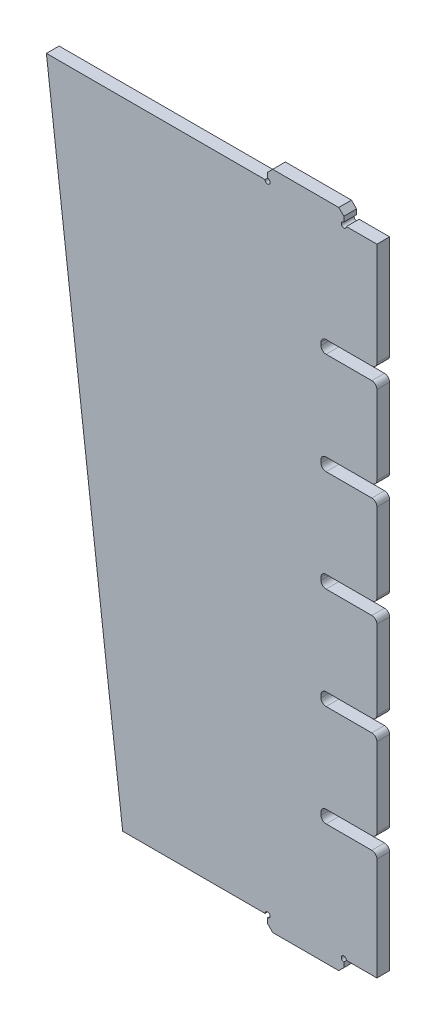
from build123d import *

# Parameters (mm, degrees)
EXTRUDE_1_DEPTH = 2.5
FILLET_1_R      = 2


with BuildPart() as part:
    # 草圖1 → 填料-伸長1 (new, symmetric)
    with BuildSketch(Plane.XY):
        with BuildLine():
            Line((-15, 2), (-13, 0))
            Line((-13, 0), (13, 0))
            Line((13, 0), (15, 2))
            Line((15, 2), (15, 4))
            ThreePointArc((15, 4), (14.292893219, 5.707106781), (16, 5))
            Line((16, 5), (28, 5))
            Line((28, 5), (28, 47.5))
            Line((28, 47.5), (6, 47.5))
            Line((6, 47.5), (6, 52.5))
            Line((6, 52.5), (28, 52.5))
            Line((28, 52.5), (28, 87.5))
            Line((28, 87.5), (6, 87.5))
            Line((6, 87.5), (6, 92.5))
            Line((6, 92.5), (28, 92.5))
            Line((28, 92.5), (28, 127.5))
            Line((28, 127.5), (6, 127.5))
            Line((6, 127.5), (6, 132.5))
            Line((6, 132.5), (28, 132.5))
            Line((28, 132.5), (28, 167.5))
            Line((28, 167.5), (6, 167.5))
            Line((6, 167.5), (6, 172.5))
            Line((6, 172.5), (28, 172.5))
            Line((28, 172.5), (28, 207.5))
            Line((28, 207.5), (6, 207.5))
            Line((6, 207.5), (6, 212.5))
            Line((6, 212.5), (28, 212.5))
            Line((28, 212.5), (28, 255))
            Line((28, 255), (16, 255))
            ThreePointArc((16, 255), (14.292893219, 254.292893219), (15, 256))
            Line((15, 256), (15, 258))
            Line((15, 258), (13, 260))
            Line((13, 260), (-13, 260))
            Line((-13, 260), (-15, 258))
            Line((-15, 258), (-15, 256))
            ThreePointArc((-15, 256), (-14.292893219, 254.292893219), (-16, 255))
            Line((-16, 255), (-102, 255))
            Line((-102, 255), (-72, 5))
            Line((-72, 5), (-16, 5))
            ThreePointArc((-16, 5), (-14.292893219, 5.707106781), (-15, 4))
            Line((-15, 4), (-15, 2))
        make_face()
    extrude(amount=EXTRUDE_1_DEPTH, both=True)

    # 圓角1
    fillet_1_edges = [part.edges().sort_by_distance(p)[0] for p in [
        (6, 52.5, 0),
        (6, 47.5, 0),
        (28, 47.5, 0),
        (28, 52.5, 0),
        (6, 92.5, 0),
        (6, 87.5, 0),
        (28, 87.5, 0),
        (28, 92.5, 0),
        (6, 127.5, 0),
        (6, 132.5, 0),
        (28, 127.5, 0),
        (28, 132.5, 0),
        (6, 212.5, 0),
        (6, 207.5, 0),
        (28, 212.5, 0),
        (28, 207.5, 0),
        (28, 167.5, 0),
        (28, 172.5, 0),
        (6, 167.5, 0),
        (6, 172.5, 0),
    ]]
    fillet(fillet_1_edges, radius=FILLET_1_R)


solid = part.part
